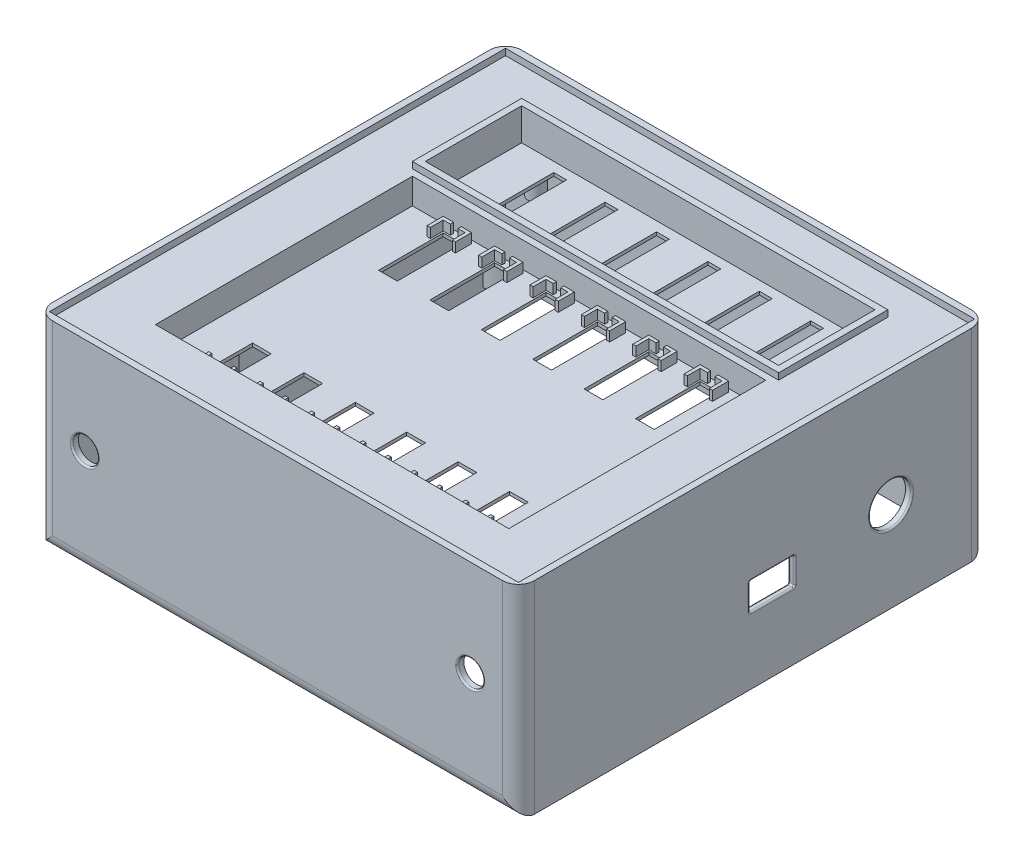
from build123d import *

# Parameters (mm, degrees)
SKETCH1_W           = 150
SKETCH1_H           = 131
BOSS_EXTRUDE1_DEPTH = 63
SKETCH2_W           = 110
SKETCH2_H           = 30
CUT_EXTRUDE1_DEPTH  = 10
SKETCH3_W           = 146
SKETCH3_H           = 127
SKETCH3_W_2         = 114
SKETCH3_H_2         = 34
CUT_EXTRUDE2_DEPTH  = 2
SKETCH5_W           = 110
SKETCH5_H           = 80
CUT_EXTRUDE3_DEPTH  = 8
SKETCH6_W           = 146
SKETCH6_H           = 127
CUT_EXTRUDE4_DEPTH  = 52
SKETCH7_W           = 4
SKETCH7_H           = 25
CUT_EXTRUDE5_DEPTH  = 1.2
SKETCH8_W           = 5.820563052
SKETCH8_H           = 15.644299527
SKETCH8_H_2         = 20.126273565
CUT_EXTRUDE6_DEPTH  = 1.2
BOSS_EXTRUDE2_DEPTH = 3
SKETCH10_R          = 2.5
BOSS_EXTRUDE3_DEPTH = 8.5
FILLET1_R           = 2
FILLET2_R           = 2
SKETCH11_R          = 1.5
CUT_EXTRUDE7_DEPTH  = 5
SKETCH12_R          = 1.5
CUT_EXTRUDE8_DEPTH  = 5
SKETCH13_W          = 150
SKETCH13_H          = 15
BOSS_EXTRUDE4_DEPTH = 63
SKETCH14_W          = 146
SKETCH14_H          = 15
CUT_EXTRUDE9_DEPTH  = 2
SKETCH15_W          = 146
SKETCH15_H          = 15
CUT_EXTRUDE10_DEPTH = 52
BOSS_EXTRUDE5_DEPTH = 10
SKETCH18_W          = 146
SKETCH18_H          = 142
CUT_EXTRUDE11_DEPTH = 2
SKETCH19_R          = 1.5
CUT_EXTRUDE12_DEPTH = 5
SKETCH21_R          = 6.5
CUT_EXTRUDE14_DEPTH = 5
FILLET3_R           = 0.5
SKETCH22_R          = 4
CUT_EXTRUDE15_DEPTH = 5
FILLET4_R           = 0.5
SKETCH23_W          = 14
SKETCH23_H          = 8.5
CUT_EXTRUDE16_DEPTH = 5
FILLET5_R           = 0.5
FILLET7_R           = 5
SKETCH24_R          = 3.5
BOSS_EXTRUDE6_DEPTH = 2
SKETCH20_R          = 1.5
CUT_EXTRUDE17_DEPTH = 5


with BuildPart() as part:
    # Sketch1 → Boss-Extrude1 (new body)
    with BuildSketch(Plane(origin=(0, 0, 0), x_dir=(1, 0, 0), z_dir=(0, 1, 0))):
        Rectangle(SKETCH1_W, SKETCH1_H)
    extrude(amount=-BOSS_EXTRUDE1_DEPTH)

    # Sketch2 → Cut-Extrude1 (cut)
    with BuildSketch(Plane(origin=(0, 0, 0), x_dir=(1, 0, 0), z_dir=(0, 1, 0))):
        with Locations((0, 35.5)):
            Rectangle(SKETCH2_W, SKETCH2_H)
    extrude(amount=-CUT_EXTRUDE1_DEPTH, mode=Mode.SUBTRACT)

    # Sketch3 → Cut-Extrude2 (cut)
    with BuildSketch(Plane(origin=(0, 0, 0), x_dir=(1, 0, 0), z_dir=(0, 1, 0))):
        Rectangle(SKETCH3_W, SKETCH3_H)
        with Locations((0, 35.5)):
            Rectangle(SKETCH3_W_2, SKETCH3_H_2, mode=Mode.SUBTRACT)
    extrude(amount=-CUT_EXTRUDE2_DEPTH, mode=Mode.SUBTRACT)

    # Sketch5 → Cut-Extrude3 (cut)
    with BuildSketch(Plane(origin=(0, -2, 0), x_dir=(1, 0, 0), z_dir=(0, 1, 0))):
        with Locations((0, -23.5)):
            Rectangle(SKETCH5_W, SKETCH5_H)
    extrude(amount=-CUT_EXTRUDE3_DEPTH, mode=Mode.SUBTRACT)

    # Sketch6 → Cut-Extrude4 (cut)
    with BuildSketch(Plane.XZ.offset(63)):
        Rectangle(SKETCH6_W, SKETCH6_H)
    extrude(amount=-CUT_EXTRUDE4_DEPTH, mode=Mode.SUBTRACT)

    # Sketch7 → Cut-Extrude5 (cut)
    with BuildSketch(Plane(origin=(0, -10, 0), x_dir=(1, 0, 0), z_dir=(0, 1, 0))):
        with Locations((-40, 35)):
            Rectangle(SKETCH7_W, SKETCH7_H)
        with Locations((-24, 35)):
            Rectangle(SKETCH7_W, SKETCH7_H)
        with Locations((-8, 35)):
            Rectangle(SKETCH7_W, SKETCH7_H)
        with Locations((8, 35)):
            Rectangle(SKETCH7_W, SKETCH7_H)
        with Locations((24, 35)):
            Rectangle(SKETCH7_W, SKETCH7_H)
        with Locations((40, 35)):
            Rectangle(SKETCH7_W, SKETCH7_H)
    extrude(amount=-CUT_EXTRUDE5_DEPTH, mode=Mode.SUBTRACT)

    # Sketch8 → Cut-Extrude6 (cut)
    with BuildSketch(Plane(origin=(0, -10, 0), x_dir=(1, 0, 0), z_dir=(0, 1, 0))):
        with Locations((-40, -53.177850237)):
            Rectangle(SKETCH8_W, SKETCH8_H)
        with Locations((-40, 3.936863218)):
            Rectangle(SKETCH8_W, SKETCH8_H_2)
        with Locations((-24, -53.177850237)):
            Rectangle(SKETCH8_W, SKETCH8_H)
        with Locations((-24, 3.936863218)):
            Rectangle(SKETCH8_W, SKETCH8_H_2)
        with Locations((-8, -53.177850237)):
            Rectangle(SKETCH8_W, SKETCH8_H)
        with Locations((-8, 3.936863218)):
            Rectangle(SKETCH8_W, SKETCH8_H_2)
        with Locations((8, -53.177850237)):
            Rectangle(SKETCH8_W, SKETCH8_H)
        with Locations((24, -53.177850237)):
            Rectangle(SKETCH8_W, SKETCH8_H)
        with Locations((40, -53.177850237)):
            Rectangle(SKETCH8_W, SKETCH8_H)
        with Locations((8, 3.936863218)):
            Rectangle(SKETCH8_W, SKETCH8_H_2)
        with Locations((24, 3.936863218)):
            Rectangle(SKETCH8_W, SKETCH8_H_2)
        with Locations((40, 3.936863218)):
            Rectangle(SKETCH8_W, SKETCH8_H_2)
    extrude(amount=-CUT_EXTRUDE6_DEPTH, mode=Mode.SUBTRACT)

    # Sketch9 → Boss-Extrude2 (add)
    with BuildSketch(Plane(origin=(0, -10, 0), x_dir=(1, 0, 0), z_dir=(0, 1, 0))):
        Polygon((-41.160281526, 14.5), (-43.410281526, 14.5), (-43.410281526, 10.5), (-44.410281526, 10.5), (-44.410281526, 15.5), (-41.160281526, 15.5), align=None)
        Polygon((-35.589718474, 15.5), (-38.839718474, 15.5), (-38.839718474, 14.5), (-36.589718474, 14.5), (-36.589718474, 10.5), (-35.589718474, 10.5), align=None)
        Polygon((-44.410281526, -62.5), (-41.160281526, -62.5), (-41.160281526, -61.5), (-43.410281526, -61.5), (-43.410281526, -57.5), (-44.410281526, -57.5), align=None)
        Polygon((-35.589718474, -57.5), (-35.589718474, -62.5), (-38.839718474, -62.5), (-38.839718474, -61.5), (-36.589718474, -61.5), (-36.589718474, -57.5), align=None)
        Polygon((-19.589718474, -57.5), (-19.589718474, -62.5), (-22.839718474, -62.5), (-22.839718474, -61.5), (-20.589718474, -61.5), (-20.589718474, -57.5), align=None)
        Polygon((-27.410281526, -57.5), (-28.410281526, -57.5), (-28.410281526, -62.5), (-25.160281526, -62.5), (-25.160281526, -61.5), (-27.410281526, -61.5), align=None)
        Polygon((-19.589718474, 15.5), (-22.839718474, 15.5), (-22.839718474, 14.5), (-20.589718474, 14.5), (-20.589718474, 10.5), (-19.589718474, 10.5), align=None)
        Polygon((-28.410281526, 10.5), (-28.410281526, 15.5), (-25.160281526, 15.5), (-25.160281526, 14.5), (-27.410281526, 14.5), (-27.410281526, 10.5), align=None)
        Polygon((-11.410281526, -57.5), (-12.410281526, -57.5), (-12.410281526, -62.5), (-9.160281526, -62.5), (-9.160281526, -61.5), (-11.410281526, -61.5), align=None)
        Polygon((-4.589718474, -61.5), (-4.589718474, -57.5), (-3.589718474, -57.5), (-3.589718474, -62.5), (-6.839718474, -62.5), (-6.839718474, -61.5), align=None)
        Polygon((-12.410281526, 10.5), (-12.410281526, 15.5), (-9.160281526, 15.5), (-9.160281526, 14.5), (-11.410281526, 14.5), (-11.410281526, 10.5), align=None)
        Polygon((-4.589718474, 10.5), (-3.589718474, 10.5), (-3.589718474, 15.5), (-6.839718474, 15.5), (-6.839718474, 14.5), (-4.589718474, 14.5), align=None)
        Polygon((6.839718474, -61.5), (4.589718474, -61.5), (4.589718474, -57.5), (3.589718474, -57.5), (3.589718474, -62.5), (6.839718474, -62.5), align=None)
        Polygon((11.410281526, -61.5), (11.410281526, -57.5), (12.410281526, -57.5), (12.410281526, -62.5), (9.160281526, -62.5), (9.160281526, -61.5), align=None)
        Polygon((20.589718474, -57.5), (19.589718474, -57.5), (19.589718474, -62.5), (22.839718474, -62.5), (22.839718474, -61.5), (20.589718474, -61.5), align=None)
        Polygon((27.410281526, -61.5), (27.410281526, -57.5), (28.410281526, -57.5), (28.410281526, -62.5), (25.160281526, -62.5), (25.160281526, -61.5), align=None)
        Polygon((36.589718474, -57.5), (35.589718474, -57.5), (35.589718474, -62.5), (38.839718474, -62.5), (38.839718474, -61.5), (36.589718474, -61.5), align=None)
        Polygon((44.410281526, -57.5), (44.410281526, -62.5), (41.160281526, -62.5), (41.160281526, -61.5), (43.410281526, -61.5), (43.410281526, -57.5), align=None)
        Polygon((4.589718474, 14.5), (4.589718474, 10.5), (3.589718474, 10.5), (3.589718474, 15.5), (6.839718474, 15.5), (6.839718474, 14.5), align=None)
        Polygon((11.410281526, 10.5), (12.410281526, 10.5), (12.410281526, 15.5), (9.160281526, 15.5), (9.160281526, 14.5), (11.410281526, 14.5), align=None)
        Polygon((19.589718474, 10.5), (19.589718474, 15.5), (22.839718474, 15.5), (22.839718474, 14.5), (20.589718474, 14.5), (20.589718474, 10.5), align=None)
        Polygon((27.410281526, 10.5), (28.410281526, 10.5), (28.410281526, 15.5), (25.160281526, 15.5), (25.160281526, 14.5), (27.410281526, 14.5), align=None)
        Polygon((35.589718474, 10.5), (35.589718474, 15.5), (38.839718474, 15.5), (38.839718474, 14.5), (36.589718474, 14.5), (36.589718474, 10.5), align=None)
        Polygon((44.410281526, 15.5), (41.160281526, 15.5), (41.160281526, 14.5), (43.410281526, 14.5), (43.410281526, 10.5), (44.410281526, 10.5), align=None)
    extrude(amount=BOSS_EXTRUDE2_DEPTH)

    # Sketch10 → Boss-Extrude3 (add)
    with BuildSketch(Plane.XZ.offset(11)):
        with Locations(Location((48, -48, 0), (0, 0, 270))):
            Circle(SKETCH10_R)
        with Locations(Location((-48, -48, 0), (0, 0, 270))):
            Circle(SKETCH10_R)
        with Locations(Location((48, 48, 0), (0, 0, 270))):
            Circle(SKETCH10_R)
        with Locations(Location((-48, 48, 0), (0, 0, 270))):
            Circle(SKETCH10_R)
    extrude(amount=BOSS_EXTRUDE3_DEPTH)

    # Fillet1
    fillet1_edges = [part.edges().sort_by_distance(p)[0] for p in [
        (48, -11, -45.5),
    ]]
    fillet(fillet1_edges, radius=FILLET1_R)

    # Fillet2
    fillet2_edges = [part.edges().sort_by_distance(p)[0] for p in [
        (-48, -11, -45.5),
        (48, -11, 50.5),
        (-48, -11, 50.5),
    ]]
    fillet(fillet2_edges, radius=FILLET2_R)

    # Sketch11 → Cut-Extrude7 (cut)
    with BuildSketch(Plane.XZ.offset(19.5)):
        with Locations(Location((48, -48, 0), (0, 0, 270))):
            Circle(SKETCH11_R)
    cut_extrude7 = extrude(amount=-CUT_EXTRUDE7_DEPTH, mode=Mode.SUBTRACT)

    # Mirror1: Cut-Extrude7 across plane
    add(cut_extrude7.mirror(Plane(origin=(0, 0, 0), x_dir=(0, 0, 1), z_dir=(1, 0, 0))), mode=Mode.SUBTRACT)

    # Sketch12 → Cut-Extrude8 (cut)
    with BuildSketch(Plane.XZ.offset(19.5)):
        with Locations(Location((48, 48, 0), (0, 0, 270))):
            Circle(SKETCH12_R)
    cut_extrude8 = extrude(amount=-CUT_EXTRUDE8_DEPTH, mode=Mode.SUBTRACT)

    # Mirror3: Cut-Extrude8 across plane
    add(cut_extrude8.mirror(Plane(origin=(0, 0, 0), x_dir=(0, 0, 1), z_dir=(1, 0, 0))), mode=Mode.SUBTRACT)

    # Sketch13 → Boss-Extrude4 (add)
    with BuildSketch(Plane(origin=(0, 0, 0), x_dir=(1, 0, 0), z_dir=(0, 1, 0))):
        with Locations((0, -73)):
            Rectangle(SKETCH13_W, SKETCH13_H)
    extrude(amount=-BOSS_EXTRUDE4_DEPTH)

    # Sketch14 → Cut-Extrude9 (cut)
    with BuildSketch(Plane(origin=(0, 0, 0), x_dir=(1, 0, 0), z_dir=(0, 1, 0))):
        with Locations((0, -71)):
            Rectangle(SKETCH14_W, SKETCH14_H)
    extrude(amount=-CUT_EXTRUDE9_DEPTH, mode=Mode.SUBTRACT)

    # Sketch15 → Cut-Extrude10 (cut)
    with BuildSketch(Plane.XZ.offset(63)):
        with Locations((0, 71)):
            Rectangle(SKETCH15_W, SKETCH15_H)
    extrude(amount=-CUT_EXTRUDE10_DEPTH, mode=Mode.SUBTRACT)

    # Sketch17 → Boss-Extrude5 (add)
    with BuildSketch(Plane.XZ.offset(63)):
        with BuildLine():
            Line((73, -63.5), (66, -63.5))
            ThreePointArc((66, -63.5), (68.050252532, -58.550252532), (73, -56.5))
            Line((73, -56.5), (73, -63.5))
        make_face()
        with BuildLine():
            Line((-66, -63.5), (-73, -63.5))
            Line((-73, -63.5), (-73, -56.5))
            ThreePointArc((-73, -56.5), (-68.050252532, -58.550252532), (-66, -63.5))
        make_face()
        with BuildLine():
            Line((-66, 78.5), (-73, 78.5))
            Line((-73, 78.5), (-73, 71.5))
            ThreePointArc((-73, 71.5), (-68.050252532, 73.550252532), (-66, 78.5))
        make_face()
        with BuildLine():
            Line((73, 78.5), (73, 71.5))
            ThreePointArc((73, 71.5), (68.050252532, 73.550252532), (66, 78.5))
            Line((66, 78.5), (73, 78.5))
        make_face()
    extrude(amount=-BOSS_EXTRUDE5_DEPTH)

    # Sketch18 → Cut-Extrude11 (cut)
    with BuildSketch(Plane.XZ.offset(63)):
        with Locations((0, 7.5)):
            Rectangle(SKETCH18_W, SKETCH18_H)
    extrude(amount=-CUT_EXTRUDE11_DEPTH, mode=Mode.SUBTRACT)

    # Sketch19 → Cut-Extrude12 (cut)
    with BuildSketch(Plane.XZ.offset(61)):
        with Locations(Location((70, -60.5, 0), (0, 0, 270))):
            Circle(SKETCH19_R)
    extrude(amount=-CUT_EXTRUDE12_DEPTH, mode=Mode.SUBTRACT)

    # Sketch21 → Cut-Extrude14 (cut)
    with BuildSketch(Plane(origin=(75, 0, 0), x_dir=(0, 0, -1), z_dir=(1, 0, 0))):
        with Locations((35.5, -35)):
            Circle(SKETCH21_R)
    extrude(amount=-CUT_EXTRUDE14_DEPTH, mode=Mode.SUBTRACT)

    # Fillet3
    fillet3_edges = [part.edges().sort_by_distance(p)[0] for p in [
        (75, -35, -29),
    ]]
    fillet(fillet3_edges, radius=FILLET3_R)

    # Sketch22 → Cut-Extrude15 (cut)
    with BuildSketch(Plane.XY.offset(80.5)):
        with Locations((60, -30)):
            Circle(SKETCH22_R)
        with Locations((-60, -30)):
            Circle(SKETCH22_R)
    extrude(amount=-CUT_EXTRUDE15_DEPTH, mode=Mode.SUBTRACT)

    # Fillet4
    fillet4_edges = [part.edges().sort_by_distance(p)[0] for p in [
        (56, -30, 80.5),
        (-64, -30, 80.5),
    ]]
    fillet(fillet4_edges, radius=FILLET4_R)

    # Sketch23 → Cut-Extrude16 (cut)
    with BuildSketch(Plane(origin=(75, 0, 0), x_dir=(0, 0, -1), z_dir=(1, 0, 0))):
        with Locations((-1.5, -38)):
            Rectangle(SKETCH23_W, SKETCH23_H)
    extrude(amount=-CUT_EXTRUDE16_DEPTH, mode=Mode.SUBTRACT)

    # Fillet5
    fillet5_edges = [part.edges().sort_by_distance(p)[0] for p in [
        (73, -33.75, 1.5),
        (73, -38, 8.5),
        (73, -42.25, 1.5),
        (73, -38, -5.5),
        (74, -33.75, -5.5),
        (74, -42.25, -5.5),
        (74, -42.25, 8.5),
        (74, -33.75, 8.5),
        (75, -38, -5.5),
        (75, -33.75, 1.5),
        (75, -38, 8.5),
        (75, -42.25, 1.5),
    ]]
    fillet(fillet5_edges, radius=FILLET5_R)

    # Fillet7
    # the kernel refuses this fillet: 5 mm, written as the material it takes off along each edge
    with BuildSketch(Plane(origin=(-87.5, -63, -65.5), x_dir=(0, 1, 0), z_dir=(1, 0, 0)), Plane(origin=(-87.5, -63, 80.5), x_dir=(0, 0, -1), z_dir=(1, 0, 0))) as fillet7_piece_1:
        with BuildLine():
            CenterArc((FILLET7_R, FILLET7_R), FILLET7_R, 180, 90)
            Line((0, FILLET7_R), (0, 0))
            Line((0, 0), (FILLET7_R, 0))
        make_face()
    extrude(amount=175, mode=Mode.SUBTRACT)
    with BuildSketch(Plane(origin=(-75, 12.5, -65.5), x_dir=(1, 0, 0), z_dir=(0, -1, 0)), Plane(origin=(75, 12.5, -65.5), x_dir=(0, 0, 1), z_dir=(0, -1, 0))) as fillet7_piece_2:
        with BuildLine():
            CenterArc((FILLET7_R, FILLET7_R), FILLET7_R, 180, 90)
            Line((0, FILLET7_R), (0, 0))
            Line((0, 0), (FILLET7_R, 0))
        make_face()
    extrude(amount=88, mode=Mode.SUBTRACT)
    with BuildSketch(Plane(origin=(75, 12.5, 80.5), x_dir=(0, 0, -1), z_dir=(0, -1, 0)), Plane(origin=(-75, 12.5, 80.5), x_dir=(1, 0, 0), z_dir=(0, -1, 0))) as fillet7_piece_3:
        with BuildLine():
            CenterArc((FILLET7_R, -FILLET7_R), FILLET7_R, 90, 90)
            Line((0, -FILLET7_R), (0, 0))
            Line((0, 0), (FILLET7_R, 0))
        make_face()
    extrude(amount=88, mode=Mode.SUBTRACT)

    # Sketch24 → Boss-Extrude6 (add)
    with BuildSketch(Plane(origin=(0, 0, -65.5), x_dir=(-1, 0, 0), z_dir=(0, 0, -1))):
        with Locations((-56, -14)):
            Circle(SKETCH24_R)
        with Locations(Location((56, -14, 0), (0, 0, 180))):
            Circle(SKETCH24_R)
        with Locations((-56, -44)):
            Circle(SKETCH24_R)
        with Locations(Location((56, -44, 0), (0, 0, 180))):
            Circle(SKETCH24_R)
    extrude(amount=BOSS_EXTRUDE6_DEPTH)

    # Sketch20 → Cut-Extrude17 (cut)
    with BuildSketch(Plane.XZ.offset(61)):
        with Locations(Location((-70, -60.5, 0), (0, 0, 270))):
            Circle(SKETCH20_R)
        with Locations(Location((-70, 75.5, 0), (0, 0, 270))):
            Circle(SKETCH20_R)
        with Locations(Location((70, 75.5, 0), (0, 0, 270))):
            Circle(SKETCH20_R)
    extrude(amount=-CUT_EXTRUDE17_DEPTH, mode=Mode.SUBTRACT)


solid = part.part
